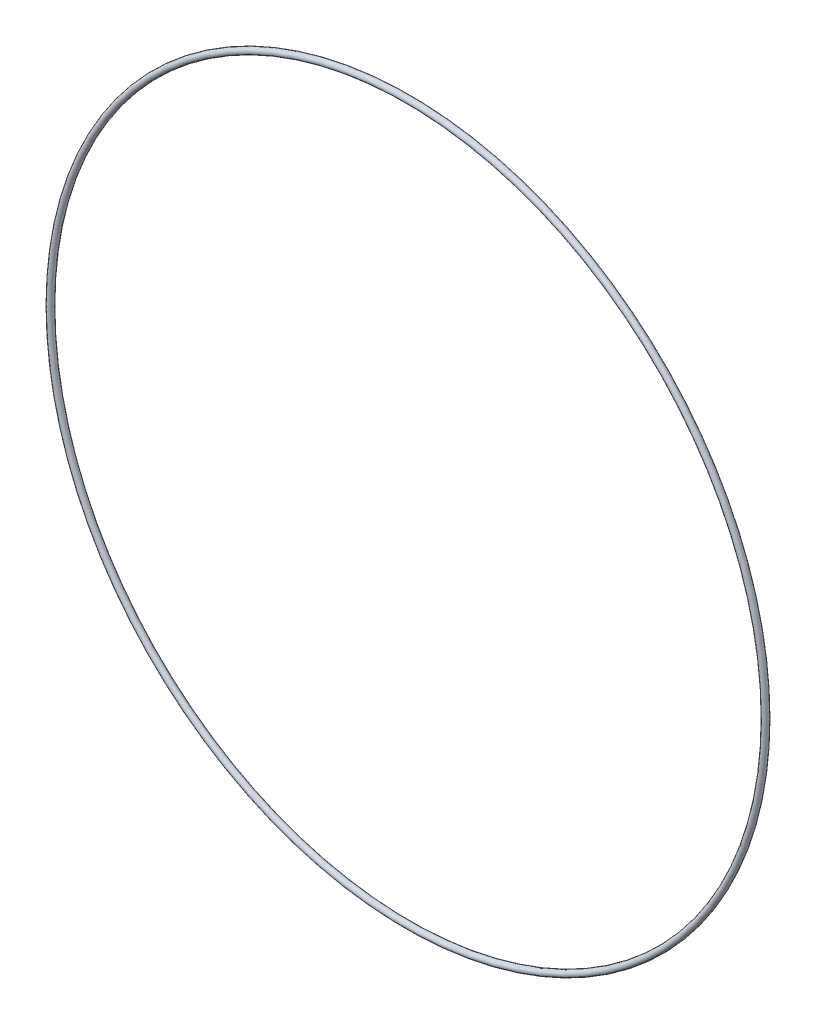
from build123d import *

# Parameters (mm, degrees)
SKETCH6_R = 1


with BuildPart() as part:
    # Sketch6 → Revolve1 (revolve)
    with BuildSketch(Plane(origin=(0, 0, 0), x_dir=(0, 0, -1), z_dir=(1, 0, 0))):
        with Locations((0, 114.5)):
            Circle(SKETCH6_R)
    revolve(axis=Axis((0, 0, 0), (0, 0, -1)))


solid = part.part
